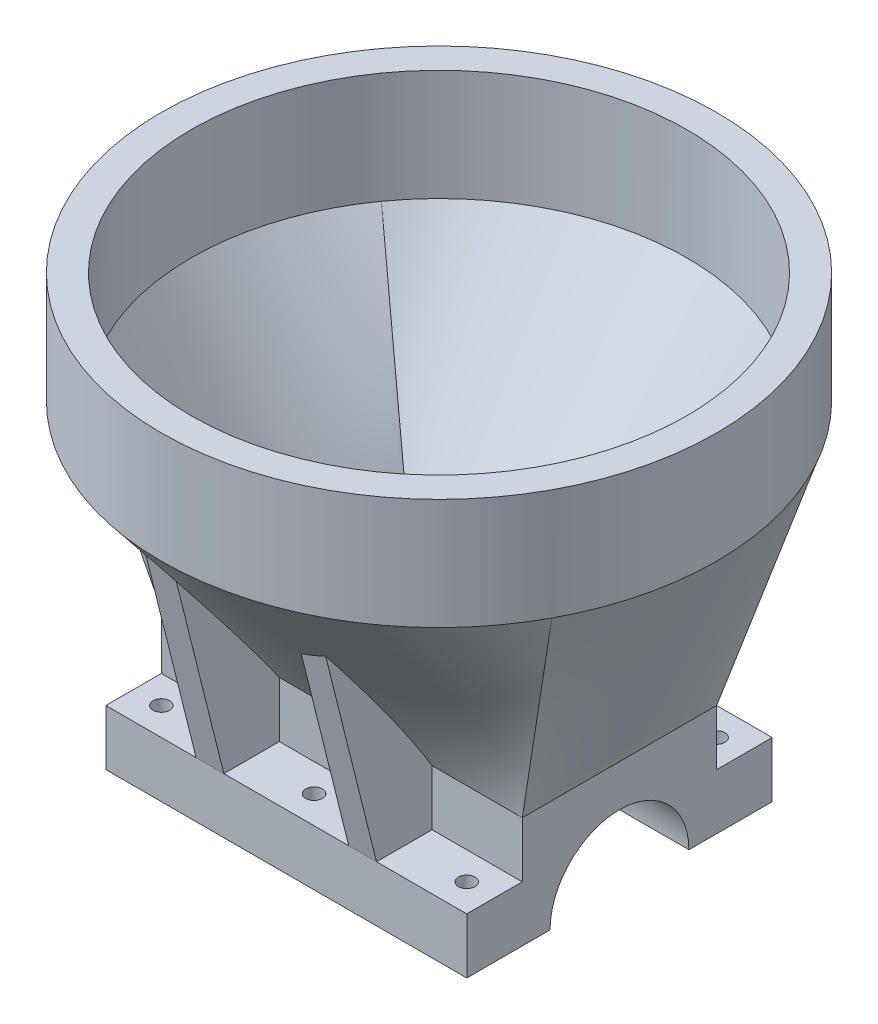
from build123d import *

# Parameters (mm, degrees)
CROQUIS2_W              = 65
CROQUIS2_H              = 35
CROQUIS2_W_2            = 35
CROQUIS2_H_2            = 25
SALIENTE_EXTRUIR1_DEPTH = 20
CROQUIS3_R              = 12.5
CORTAR_EXTRUIR1_DEPTH   = 60
CROQUIS4_R              = 6.5
CORTAR_EXTRUIR2_DEPTH   = 5
CROQUIS10_R             = 50
CROQUIS10_R_2           = 44.640302452
SALIENTE_EXTRUIR2_DEPTH = 20
CROQUIS11_W             = 65
CROQUIS11_H             = 10
CROQUIS11_R             = 1.5
SALIENTE_EXTRUIR3_DEPTH = 10
SALIENTE_EXTRUIR4_DEPTH = 2.5


with BuildPart() as part:
    # Croquis2 → Saliente-Extruir1 (new body)
    with BuildSketch(Plane(origin=(0, 0, 0), x_dir=(1, 0, 0), z_dir=(0, 1, 0))):
        with Locations((17.5, 12.5)):
            Rectangle(CROQUIS2_W, CROQUIS2_H)
        with Locations((17.5, 12.5)):
            Rectangle(CROQUIS2_W_2, CROQUIS2_H_2, mode=Mode.SUBTRACT)
    extrude(amount=SALIENTE_EXTRUIR1_DEPTH)

    # Croquis3 → Cortar-Extruir1 (cut)
    with BuildSketch(Plane(origin=(50, 0, 0), x_dir=(0, 0, -1), z_dir=(1, 0, 0))):
        with Locations((12.5, 0)):
            Circle(CROQUIS3_R)
    extrude(amount=-CORTAR_EXTRUIR1_DEPTH, mode=Mode.SUBTRACT)

    # Croquis4 → Cortar-Extruir2 (cut)
    with BuildSketch(Plane.ZY.offset(15)):
        with Locations((-12.5, 0)):
            Circle(CROQUIS4_R)
    extrude(amount=-CORTAR_EXTRUIR2_DEPTH, mode=Mode.SUBTRACT)

    # Croquis5 → Recubrir2 section 0
    with BuildSketch(Plane(origin=(0, 20, 0), x_dir=(1, 0, 0), z_dir=(0, 1, 0))):
        with BuildLine():
            Line((-15, -5), (50, -5))
            Line((50, -5), (50, 30))
            Line((50, 30), (-15, 30))
            Line((-15, 30), (-15, -5))
        make_face()
    # Croquis6 for Recubrir2 → Recubrir2 section 1
    with BuildSketch(Plane(origin=(0, 60, 0), x_dir=(1, 0, 0), z_dir=(0, 1, 0))):
        with BuildLine():
            # circular arc as an exact rational Bezier (weights 1, cos(half-angle), 1)
            Bezier((-26.523554996, -11.204991152), (17.5, -92.963021858), (61.523554996, -11.204991152), weights=[1, 0.474099823, 1])
            Bezier((61.523554996, -11.204991152), (74.287781001, 12.5), (61.523554996, 36.204991152), weights=[1, 0.8804711, 1])
            Bezier((61.523554996, 36.204991152), (17.5, 117.963021858), (-26.523554996, 36.204991152), weights=[1, 0.474099823, 1])
            Bezier((-26.523554996, 36.204991152), (-39.287781001, 12.5), (-26.523554996, -11.204991152), weights=[1, 0.8804711, 1])
        make_face()
    loft()

    # Croquis10 → Saliente-Extruir2 (add)
    with BuildSketch(Plane(origin=(0, 60, 0), x_dir=(1, 0, 0), z_dir=(0, 1, 0))):
        with Locations(Location((17.5, 12.5, 0), (0, 0, 151.699244219))):
            Circle(CROQUIS10_R)
        with Locations(Location((17.5, 12.5, 0), (0, 0, 270))):
            Circle(CROQUIS10_R_2, mode=Mode.SUBTRACT)
    extrude(amount=SALIENTE_EXTRUIR2_DEPTH)

    # Croquis11 → Saliente-Extruir3 (add)
    # profile 1 of 2: a face of its own
    with BuildSketch(Plane.XZ):
        with Locations((17.5, 10)):
            Rectangle(CROQUIS11_W, CROQUIS11_H)
        with Locations(Location((45, 10, 0), (0, 0, 270))):
            Circle(CROQUIS11_R, mode=Mode.SUBTRACT)
        with Locations(Location((-10, 10, 0), (0, 0, 270))):
            Circle(CROQUIS11_R, mode=Mode.SUBTRACT)
        with Locations(Location((17.5, 10, 0), (0, 0, 270))):
            Circle(CROQUIS11_R, mode=Mode.SUBTRACT)
    # profile 2 of 2: a face of its own
    with BuildSketch(Plane.XZ):
        with Locations((17.5, -35)):
            Rectangle(CROQUIS11_W, CROQUIS11_H)
        with Locations(Location((45, -35, 0), (0, 0, 270))):
            Circle(CROQUIS11_R, mode=Mode.SUBTRACT)
        with Locations(Location((-10, -35, 0), (0, 0, 270))):
            Circle(CROQUIS11_R, mode=Mode.SUBTRACT)
        with Locations(Location((17.5, -35, 0), (0, 0, 270))):
            Circle(CROQUIS11_R, mode=Mode.SUBTRACT)
    extrude(amount=-SALIENTE_EXTRUIR3_DEPTH)

    # Croquis12 → Saliente-Extruir4 (add, symmetric)
    with BuildSketch(Plane(origin=(31.25, 0, 0), x_dir=(0, 0, -1), z_dir=(1, 0, 0))):
        Polygon((-5, 10), (-5, 50), (-25, 50), (-15, 10), align=None)
        Polygon((30, 10), (40, 10), (50.3125, 50), (30, 50), align=None)
    saliente_extruir4 = extrude(amount=SALIENTE_EXTRUIR4_DEPTH, both=True)

    # Simetría1: Saliente-Extruir4 across plane
    add(saliente_extruir4.mirror(Plane(origin=(17.5, 0, 0), x_dir=(0, 0, 1), z_dir=(1, 0, 0))))

    # Croquis9 → Cortar-Recubrir2 section 0
    with BuildSketch(Plane(origin=(0, 20, 0), x_dir=(1, 0, 0), z_dir=(0, 1, 0))):
        with BuildLine():
            Line((0, 0), (35, 0))
            Line((35, 0), (35, 25))
            Line((35, 25), (0, 25))
            Line((0, 25), (0, 0))
        make_face()
    # Croquis8 for Cortar-Recub → Cortar-Recubrir2 section 1
    with BuildSketch(Plane(origin=(0, 60, 0), x_dir=(1, 0, 0), z_dir=(0, 1, 0))):
        with BuildLine():
            Bezier((-18.82530827, -13.446648764), (17.5, -64.302080343), (53.82530827, -13.446648764), weights=[1, 0.581238194, 1])
            Bezier((53.82530827, -13.446648764), (72.358628816, 12.5), (53.82530827, 38.446648764), weights=[1, 0.813733471, 1])
            Bezier((53.82530827, 38.446648764), (17.5, 89.302080343), (-18.82530827, 38.446648764), weights=[1, 0.581238194, 1])
            Bezier((-18.82530827, 38.446648764), (-37.358628816, 12.5), (-18.82530827, -13.446648764), weights=[1, 0.813733471, 1])
        make_face()
    loft(mode=Mode.SUBTRACT)


solid = part.part
